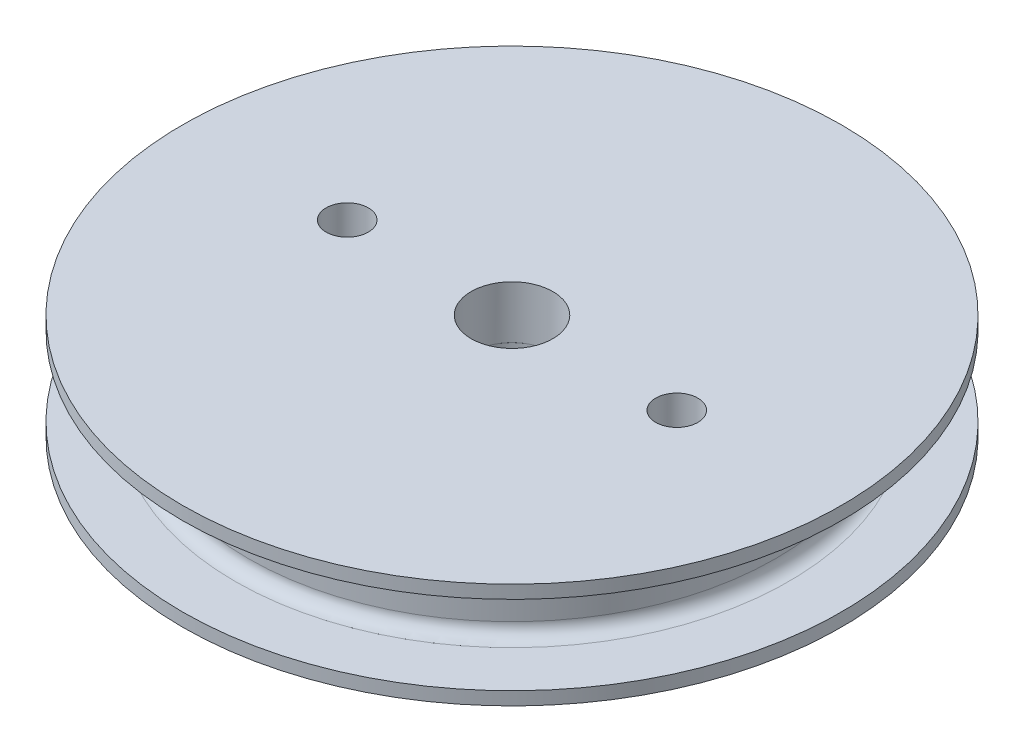
from build123d import *

# Parameters (mm, degrees)
SKETCH_2_R          = 3.1
CUT_EXTRUDE_1_DEPTH = 37.249137921
SKETCH_3_R          = 1.6
CUT_EXTRUDE_2_DEPTH = 37.249137921


with BuildPart() as part:
    # ｽｹｯﾁ1 → 回転1 (revolve)
    with BuildSketch(Plane.XY):
        with BuildLine():
            Line((0, 0), (0, 4))
            Line((0, 4), (20, 4))
            Line((20, 4), (20, 2))
            ThreePointArc((20, 2), (20.292893219, 1.292893219), (21, 1))
            Line((21, 1), (25, 1))
            Line((25, 1), (25, 0))
            Line((25, 0), (0, 0))
        make_face()
    revolve(axis=Axis((0, 0, 0), (0, 1, 0)))


with BuildPart() as body_2:
    # ﾐﾗｰ1: mirrored copy
    add(part.part.mirror(Plane.ZX.offset(4)))


with BuildPart() as cut_extrude_1_tool:
    # ｽｹｯﾁ2 → ｶｯﾄ - 押し出し1 (new, through all)
    with BuildSketch(Plane(origin=(0, 8, 0), x_dir=(1, 0, 0), z_dir=(0, 1, 0))):
        Circle(SKETCH_2_R)
    extrude(amount=-CUT_EXTRUDE_1_DEPTH)


with BuildPart() as part_1:
    add(part.part)

    # ｶｯﾄ - 押し出し1: cut by cut_extrude_1_tool
    add(cut_extrude_1_tool.part, mode=Mode.SUBTRACT)


with BuildPart() as body_2_1:
    add(body_2.part)

    # ｶｯﾄ - 押し出し1: cut by cut_extrude_1_tool
    add(cut_extrude_1_tool.part, mode=Mode.SUBTRACT)


with BuildPart() as cut_extrude_2_tool:
    # ｽｹｯﾁ3 → ｶｯﾄ - 押し出し2 (new, through all)
    with BuildSketch(Plane.XZ):
        with Locations((12.5, 0)):
            Circle(SKETCH_3_R)
        with Locations((-12.5, 0)):
            Circle(SKETCH_3_R)
    extrude(amount=-CUT_EXTRUDE_2_DEPTH)


with BuildPart() as part_2:
    add(part_1.part)

    # ｶｯﾄ - 押し出し2: cut by cut_extrude_2_tool
    add(cut_extrude_2_tool.part, mode=Mode.SUBTRACT)


with BuildPart() as body_2_2:
    add(body_2_1.part)

    # ｶｯﾄ - 押し出し2: cut by cut_extrude_2_tool
    add(cut_extrude_2_tool.part, mode=Mode.SUBTRACT)


solid = Compound([part_2.part, body_2_2.part])
